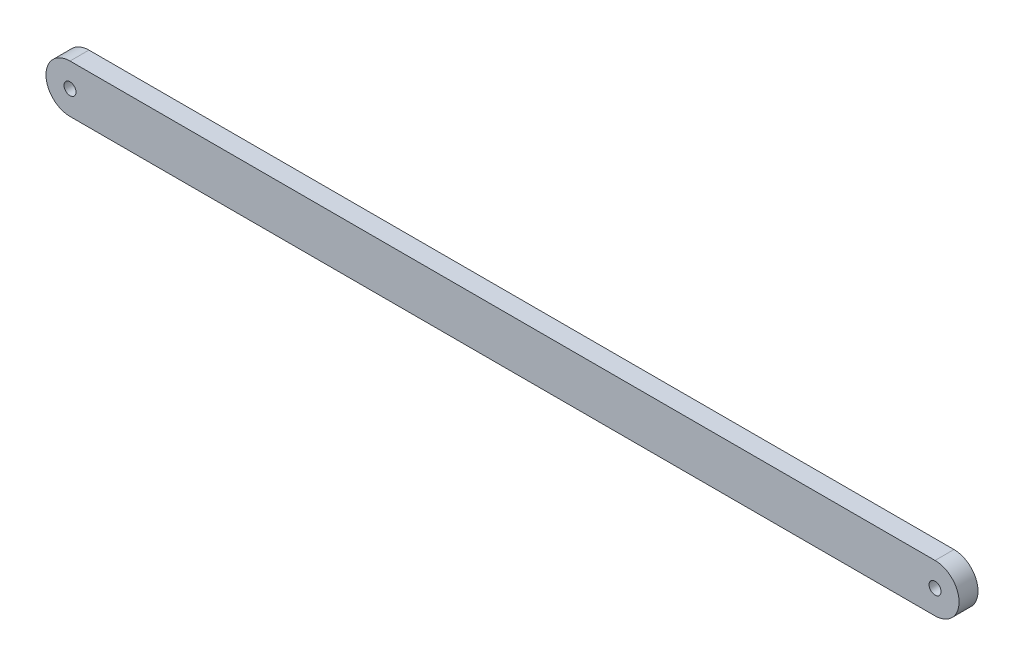
from build123d import *

# Parameters (mm, degrees)
SKETCH1_R           = 3.175
BOSS_EXTRUDE1_DEPTH = 10


with BuildPart() as part:
    # Sketch1 → Boss-Extrude1 (new body)
    with BuildSketch(Plane.XY):
        with BuildLine():
            Line((0, 12.7), (457.2, 12.7))
            ThreePointArc((457.2, 12.7), (469.9, 0), (457.2, -12.7))
            Line((457.2, -12.7), (0, -12.7))
            ThreePointArc((0, -12.7), (-12.7, 0), (0, 12.7))
        make_face()
        Circle(SKETCH1_R, mode=Mode.SUBTRACT)
        with Locations((457.2, 0)):
            Circle(SKETCH1_R, mode=Mode.SUBTRACT)
    extrude(amount=BOSS_EXTRUDE1_DEPTH)


solid = part.part
